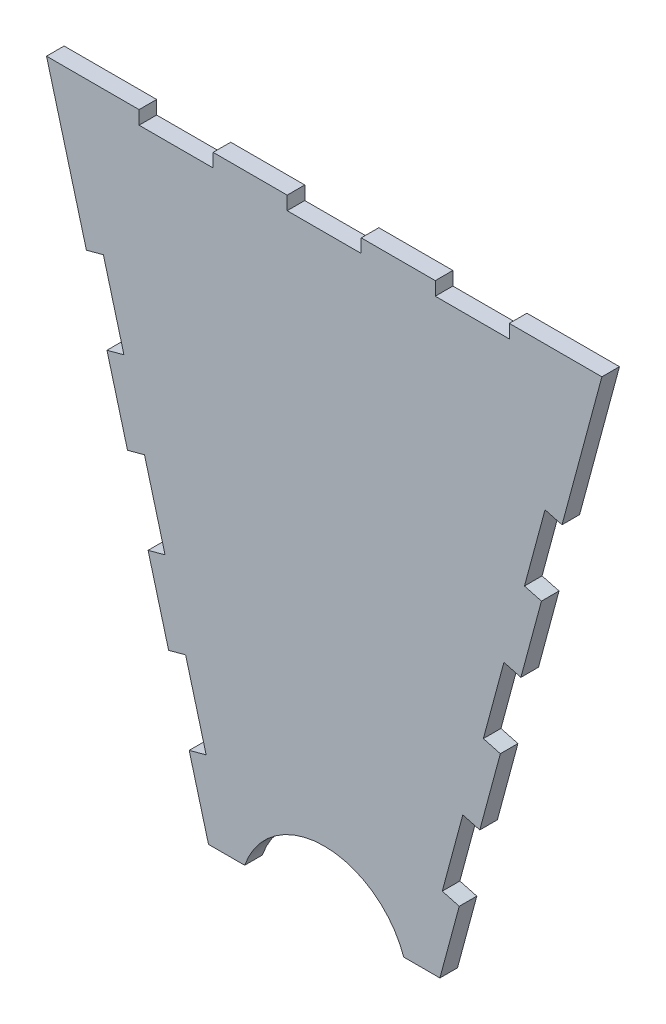
from build123d import *

# Parameters (mm, degrees)
BOSS_EXTRUDE1_DEPTH = 4.826
CUT_EXTRUDE1_DEPTH  = 225.737758901
SKETCH3_R           = 23.114
CUT_EXTRUDE2_DEPTH  = 4.826
SKETCH4_W           = 20.32
SKETCH4_H           = 4.618449328
CUT_EXTRUDE3_DEPTH  = 225.737758901
SKETCH5_W           = 20.32
SKETCH5_H           = 1.891226212
CUT_EXTRUDE4_DEPTH  = 225.737758901


with BuildPart() as part:
    # Sketch1 → Boss-Extrude1 (new body)
    with BuildSketch(Plane.XY):
        Polygon((152.4, 165.1), (0, 165.1), (44.45, 0), (107.95, 0), align=None)
    extrude(amount=BOSS_EXTRUDE1_DEPTH)

    # Sketch2 → Cut-Extrude1 (cut, through all)
    with BuildSketch(Plane.XY.offset(4.826)):
        Polygon((10.943607233, 124.452315991), (15.603668884, 125.706947974), (21.244365267, 104.755789979), (16.584303617, 103.501157996), align=None)
        Polygon((22.225, 82.55), (26.885061651, 83.804631983), (32.525758034, 62.853473987), (27.865696383, 61.598842004), align=None)
        Polygon((33.506392767, 40.647684009), (38.166454418, 41.902315991), (43.807150801, 20.951157996), (39.14708915, 19.696526013), align=None)
        Polygon((113.25291085, 19.696526013), (118.893607233, 40.647684009), (114.233545582, 41.902315991), (108.592849199, 20.951157996), align=None)
        Polygon((124.534303617, 61.598842004), (130.175, 82.55), (125.514938349, 83.804631983), (119.874241966, 62.853473987), align=None)
        Polygon((135.815696383, 103.501157996), (141.456392767, 124.452315991), (136.796331116, 125.706947974), (131.155634733, 104.755789979), align=None)
    extrude(amount=-CUT_EXTRUDE1_DEPTH, mode=Mode.SUBTRACT)

    # Sketch3 → Cut-Extrude2 (cut)
    with BuildSketch(Plane.XY.offset(4.826)):
        with Locations((76.2, -7.62)):
            Circle(SKETCH3_R)
    extrude(amount=-CUT_EXTRUDE2_DEPTH, mode=Mode.SUBTRACT)

    # Sketch4 → Cut-Extrude3 (cut, through all)
    with BuildSketch(Plane.XY.offset(4.826)):
        with Locations((116.84, 165.590919477)):
            Rectangle(SKETCH4_W, SKETCH4_H)
        with Locations((76.2, 165.590919477)):
            Rectangle(SKETCH4_W, SKETCH4_H)
        with Locations((35.56, 165.590919477)):
            Rectangle(SKETCH4_W, SKETCH4_H)
    extrude(amount=-CUT_EXTRUDE3_DEPTH, mode=Mode.SUBTRACT)

    # Sketch5 → Cut-Extrude4 (cut, through all)
    with BuildSketch(Plane.XY.offset(4.826)):
        with Locations((116.84, 162.336081707)):
            Rectangle(SKETCH5_W, SKETCH5_H)
        with Locations((76.2, 162.336081707)):
            Rectangle(SKETCH5_W, SKETCH5_H)
        with Locations((35.56, 162.336081707)):
            Rectangle(SKETCH5_W, SKETCH5_H)
    extrude(amount=-CUT_EXTRUDE4_DEPTH, mode=Mode.SUBTRACT)


solid = part.part
